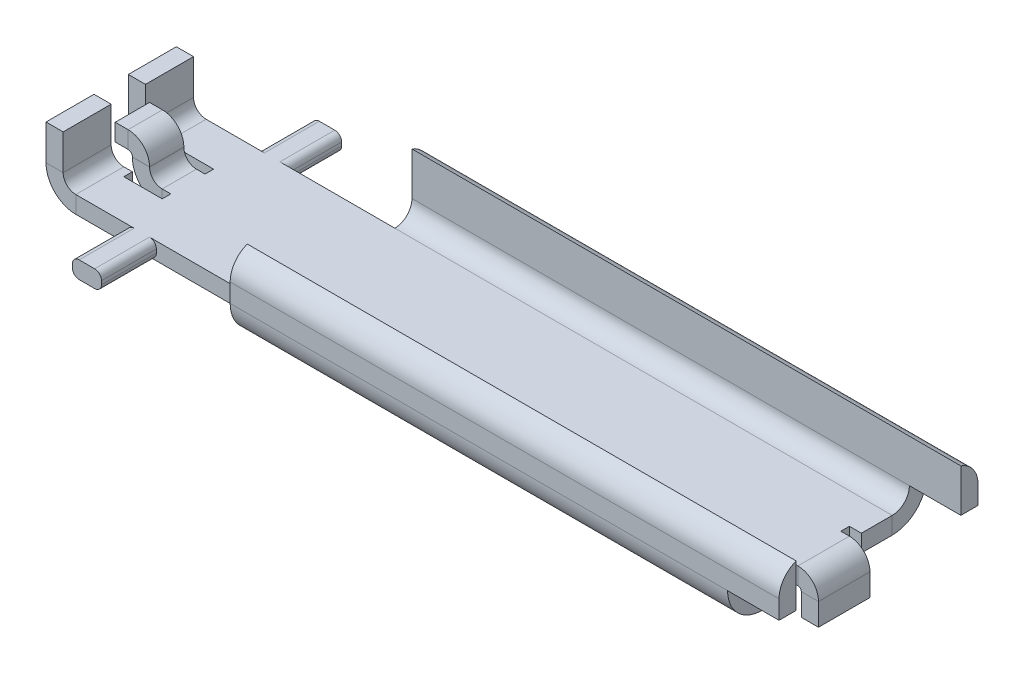
from build123d import *

# Parameters (mm, degrees)
BASE_FLANGE2_DEPTH              = 45
FRONT_CUT_DEPTH                 = 2
FRONT_STRIP_W                   = 4.4
FRONT_STRIP_H                   = 1
FRONT_STRIP_CUT_DEPTH           = 3
FRONT_RELIEF_W                  = 4.9
FRONT_RELIEF_H                  = 0.5
FRONT_RELIEF_CUT_DEPTH          = 1
FRONT_DEPTH                     = 3
BACK_CUT_DEPTH                  = 13
GUIDING_PINS_DEPTH              = 7
FILLET3_R                       = 1.5
BACK_START                      = -3.8
BACK_2_BENDS_DEPTH              = 7.6
BACK_2_BENDS_2_DEPTH            = 7.6
MIDDLE_CUT_DEPTH                = 46.675485766
MIDDLE_CUT_DEPTH_BACK           = 46.675485766
SKETCH32_W                      = 2.5
SKETCH32_H                      = 2
MIDDLE_START                    = -1.5
MIDDLE_SPRING_1_DEPTH           = 3
MIDDLE_SPRING_1_2_DEPTH         = 0.5
MIDDLE_START_2                  = 1
MIDDLE_SPRING_1_3_DEPTH         = 0.5
MIDDLE_START_3                  = -1
MIDDLE_SPRING_1_4_DEPTH         = 2
MIDDLE_SPRING_2_STRIP_W         = 4.5
MIDDLE_SPRING_2_STRIP_H         = 1
MIDDLE_SPRING_2_STRIP_CUT_DEPTH = 2
MIDDLE_SPRING_2_DEPTH           = 2
SKETCH50_W                      = 1
SKETCH50_H                      = 2.8
BACK_2_BENDS_EXTENSION_DEPTH    = 2


# Read off the part's stored shape, not the designer's step: back cut, back 2 bends, middle spring 1
# Sheet-metal steps are written as plain solids
with BuildPart() as part:
    # Sketch6 → Base-Flange2 (new body)
    with BuildSketch(Plane(origin=(0, 0, 0), x_dir=(0, 0, -1), z_dir=(1, 0, 0))):
        with BuildLine():
            Line((-4.8, 3.5), (-4.8, 1))
            ThreePointArc((-4.8, 1), (-4.507106781, 0.292893219), (-3.8, 0))
            Line((-3.8, 0), (3.8, 0))
            ThreePointArc((3.8, 0), (4.507106781, 0.292893219), (4.8, 1))
            Line((4.8, 1), (4.8, 3.5))
            Line((4.8, 3.5), (5.8, 3.5))
            Line((5.8, 3.5), (5.8, 1))
            ThreePointArc((5.8, 1), (5.214213562, -0.414213562), (3.8, -1))
            Line((3.8, -1), (-3.8, -1))
            ThreePointArc((-3.8, -1), (-5.214213562, -0.414213562), (-5.8, 1))
            Line((-5.8, 1), (-5.8, 3.5))
            Line((-5.8, 3.5), (-4.8, 3.5))
        make_face()
    extrude(amount=BASE_FLANGE2_DEPTH)

    # Sketch51 → front cut (cut)
    with BuildSketch(Plane.XZ.offset(1)):
        Polygon((42, 1.5), (43, 1.5), (43, -1.5), (42, -1.5), (42, -6), (46, -6), (46, -1.5), (45, -1.5), (45, 1.5), (46, 1.5), (46, 6), (42, 6), align=None)
    extrude(amount=-FRONT_CUT_DEPTH, mode=Mode.SUBTRACT)

    # front strip (across the edge) → front strip cut (cut)
    with BuildSketch(Plane(origin=(43, -1, -1.5), x_dir=(-1, 0, 0), z_dir=(0, 0, 1))):
        with Locations((-1, -0.5)):
            Rectangle(FRONT_STRIP_W, FRONT_STRIP_H)
    extrude(amount=FRONT_STRIP_CUT_DEPTH, mode=Mode.SUBTRACT)

    # front relief (on the sheet) → front relief cut (cut)
    with BuildSketch(Plane(origin=(41.8, -1, -1.5), x_dir=(-1, 0, 0), z_dir=(0, -1, 0))):
        with Locations((-1.95, 0.25)):
            Rectangle(FRONT_RELIEF_W, FRONT_RELIEF_H)
        with Locations((-1.95, -3.25)):
            Rectangle(FRONT_RELIEF_W, FRONT_RELIEF_H)
    extrude(amount=-FRONT_RELIEF_CUT_DEPTH, mode=Mode.SUBTRACT)

    # front section (across the edge) → front (add)
    with BuildSketch(Plane(origin=(43, -1, -1.5), x_dir=(-1, 0, 0), z_dir=(0, 0, 1))):
        with BuildLine():
            Line((0, 0.2), (0, 1.5))
            Line((0, 1.5), (1, 1.5))
            Line((1, 1.5), (1, 0.2))
            ThreePointArc((1, 0.2), (1.058578644, 0.058578644), (1.2, 0))
            Line((1.2, 0), (1.2, -1))
            ThreePointArc((1.2, -1), (0.351471863, -0.648528137), (0, 0.2))
        make_face()
    extrude(amount=FRONT_DEPTH)

    # back cut outline → back cut (cut)
    with BuildSketch(Plane.YZ):
        with BuildLine():
            Line((-1, 3.8), (0, 3.8))
            ThreePointArc((0, 3.8), (0.292893219, 4.507106781), (1, 4.8))
            Line((1, 4.8), (3.5, 4.8))
            Line((3.5, 4.8), (3.5, 5.8))
            Line((3.5, 5.8), (1, 5.8))
            ThreePointArc((1, 5.8), (-0.414213562, 5.214213562), (-1, 3.8))
        make_face()
        with BuildLine():
            ThreePointArc((1, -4.8), (0.292893219, -4.507106781), (0, -3.8))
            Line((0, -3.8), (-1, -3.8))
            ThreePointArc((-1, -3.8), (-0.414213562, -5.214213562), (1, -5.8))
            Line((1, -5.8), (3.5, -5.8))
            Line((3.5, -5.8), (3.5, -4.8))
            Line((3.5, -4.8), (1, -4.8))
        make_face()
    extrude(amount=BACK_CUT_DEPTH, mode=Mode.SUBTRACT)

    # Sketch27 → guiding pins (add, symmetric)
    with BuildSketch(Plane.XY):
        with BuildLine():
            Line((5.4, 0), (6.3, 0))
            ThreePointArc((6.3, 0), (6.582842712, -0.117157288), (6.7, -0.4))
            Line((6.7, -0.4), (6.7, -0.6))
            ThreePointArc((6.7, -0.6), (6.582842712, -0.882842712), (6.3, -1))
            Line((6.3, -1), (5.4, -1))
            ThreePointArc((5.4, -1), (5.117157288, -0.882842712), (5, -0.6))
            Line((5, -0.6), (5, -0.4))
            ThreePointArc((5, -0.4), (5.117157288, -0.117157288), (5.4, 0))
        make_face()
    extrude(amount=GUIDING_PINS_DEPTH, both=True)

    # Fillet3
    # the kernel refuses this fillet: 1.5 mm, written as the material it takes off along each edge
    with BuildSketch(Plane(origin=(9.464466094, 3.5, 5.8), x_dir=(0, -1, 0), z_dir=(1, 0, 0))) as fillet3_piece_1:
        with BuildLine():
            CenterArc((1.414213562, 1.5), FILLET3_R, 199.471220634, 70.528779366)
            Line((0, 1), (-0.028284271, 0.99))
            ThreePointArc((-0.028284271, 0.99), (-0.03, 0.5), (-0.03, 0))
            Line((-0.03, 0), (0, -0.03))
            Line((0, -0.03), (1.414213562, -0.03))
            Line((1.414213562, -0.03), (1.414213562, 0))
        make_face()
    extrude(amount=39.071067812, mode=Mode.SUBTRACT)
    with BuildSketch(Plane(origin=(9.464466094, 3.5, -5.8), x_dir=(0, -1, 0), z_dir=(1, 0, 0))) as fillet3_piece_2:
        with BuildLine():
            CenterArc((1.414213562, -1.5), FILLET3_R, 90, 70.528779366)
            Line((0, -1), (-0.028284271, -0.99))
            ThreePointArc((-0.028284271, -0.99), (-0.03, -0.5), (-0.03, 0))
            Line((-0.03, 0), (0, 0.03))
            Line((0, 0.03), (1.414213562, 0.03))
            Line((1.414213562, 0.03), (1.414213562, 0))
        make_face()
    extrude(amount=39.071067812, mode=Mode.SUBTRACT)

    # back 2 bends outline → back 2 bends (cut)
    with BuildSketch(Plane.XY.offset(BACK_START)):
        with BuildLine():
            Line((0, -1), (2, -1))
            ThreePointArc((2, -1), (1.068173836, -0.728828115), (0.42735891, 0))
            Line((0.42735891, 0), (0, 0))
            Line((0, 0), (0, -1))
        make_face()
    extrude(amount=BACK_2_BENDS_DEPTH, mode=Mode.SUBTRACT)

    # back 2 bends 2 outline → back 2 bends 2 (add)
    with BuildSketch(Plane.XY.offset(BACK_START)):
        with BuildLine():
            ThreePointArc((0.2634, 0.7366), (0.304885243, 0.359286442), (0.42735891, 0))
            Line((0.42735891, 0), (2, 0))
            ThreePointArc((2, 0), (1.479145145, 0.215745145), (1.2634, 0.7366))
            Line((1.2634, 0.7366), (1.2634, 0.794153262))
            Line((1.2634, 0.794153262), (0.2634, 0.794153262))
            Line((0.2634, 0.794153262), (0.2634, 0.7366))
        make_face()
    extrude(amount=BACK_2_BENDS_2_DEPTH)

    # Sketch32 → middle cut (cut, two sides: drawn at the far end of the back side and taken through both)
    with BuildSketch(Plane(origin=(0, 0, 0), x_dir=(1, 0, 0), z_dir=(0, 1, 0)).offset(-MIDDLE_CUT_DEPTH_BACK)):
        with Locations((1.25, 0)):
            Rectangle(SKETCH32_W, SKETCH32_H)
    extrude(amount=MIDDLE_CUT_DEPTH + MIDDLE_CUT_DEPTH_BACK, mode=Mode.SUBTRACT)

    # middle spring 1 outline → middle spring 1 (cut)
    with BuildSketch(Plane.XY.offset(MIDDLE_START)):
        with BuildLine():
            Line((2.5, 0), (2.5, -1))
            Line((2.5, -1), (4.2366, -1))
            ThreePointArc((4.2366, -1), (3.304773836, -0.728828115), (2.66395891, 0))
            Line((2.66395891, 0), (2.5, 0))
        make_face()
    extrude(amount=MIDDLE_SPRING_1_DEPTH, mode=Mode.SUBTRACT)

    # middle spring 1 2 outline → middle spring 1 2 (cut)
    with BuildSketch(Plane.XY.offset(MIDDLE_START)):
        with BuildLine():
            ThreePointArc((2.66395891, 0), (3.304773836, -0.728828115), (4.2366, -1))
            Line((4.2366, -1), (4.7366, -1))
            Line((4.7366, -1), (4.7366, 0))
            Line((4.7366, 0), (2.66395891, 0))
        make_face()
    extrude(amount=MIDDLE_SPRING_1_2_DEPTH, mode=Mode.SUBTRACT)

    # middle spring 1 3 outline → middle spring 1 3 (cut)
    with BuildSketch(Plane.XY.offset(MIDDLE_START_2)):
        with BuildLine():
            ThreePointArc((2.66395891, 0), (3.304773836, -0.728828115), (4.2366, -1))
            Line((4.2366, -1), (4.7366, -1))
            Line((4.7366, -1), (4.7366, 0))
            Line((4.7366, 0), (2.66395891, 0))
        make_face()
    extrude(amount=MIDDLE_SPRING_1_3_DEPTH, mode=Mode.SUBTRACT)

    # middle spring 1 4 outline → middle spring 1 4 (add)
    with BuildSketch(Plane.XY.offset(MIDDLE_START_3)):
        with BuildLine():
            ThreePointArc((2.5, 0.7366), (2.541485243, 0.359286442), (2.66395891, 0))
            Line((2.66395891, 0), (4.2366, 0))
            ThreePointArc((4.2366, 0), (3.715745145, 0.215745145), (3.5, 0.7366))
            Line((3.5, 0.7366), (3.5, 2))
            Line((3.5, 2), (2.5, 2))
            Line((2.5, 2), (2.5, 0.7366))
        make_face()
    extrude(amount=MIDDLE_SPRING_1_4_DEPTH)

    # middle spring 2 strip (across the edge) → middle spring 2 strip cut (cut)
    with BuildSketch(Plane(origin=(2.5, 2, 1), x_dir=(0, -1, 0), z_dir=(0, 0, -1))):
        with Locations((-1, -0.5)):
            Rectangle(MIDDLE_SPRING_2_STRIP_W, MIDDLE_SPRING_2_STRIP_H)
    extrude(amount=MIDDLE_SPRING_2_STRIP_CUT_DEPTH, mode=Mode.SUBTRACT)

    # middle spring 2 section (across the edge) → middle spring 2 (add)
    with BuildSketch(Plane(origin=(2.5, 2, 1), x_dir=(0, -1, 0), z_dir=(0, 0, -1))):
        with BuildLine():
            Line((0, 0.25), (0, 1))
            Line((0, 1), (1, 1))
            Line((1, 1), (1, 0.25))
            ThreePointArc((1, 0.25), (1.073223305, 0.073223305), (1.25, 0))
            Line((1.25, 0), (1.25, -1))
            ThreePointArc((1.25, -1), (0.366116524, -0.633883476), (0, 0.25))
        make_face()
    extrude(amount=MIDDLE_SPRING_2_DEPTH)

    # Sketch50 → back 2 bends extension (add)
    with BuildSketch(Plane(origin=(0, 0.794153262, 0), x_dir=(1, 0, 0), z_dir=(0, 1, 0))):
        with Locations((0.7634, -2.4)):
            Rectangle(SKETCH50_W, SKETCH50_H)
        with Locations((0.7634, 2.4)):
            Rectangle(SKETCH50_W, SKETCH50_H)
    extrude(amount=BACK_2_BENDS_EXTENSION_DEPTH)


solid = part.part
